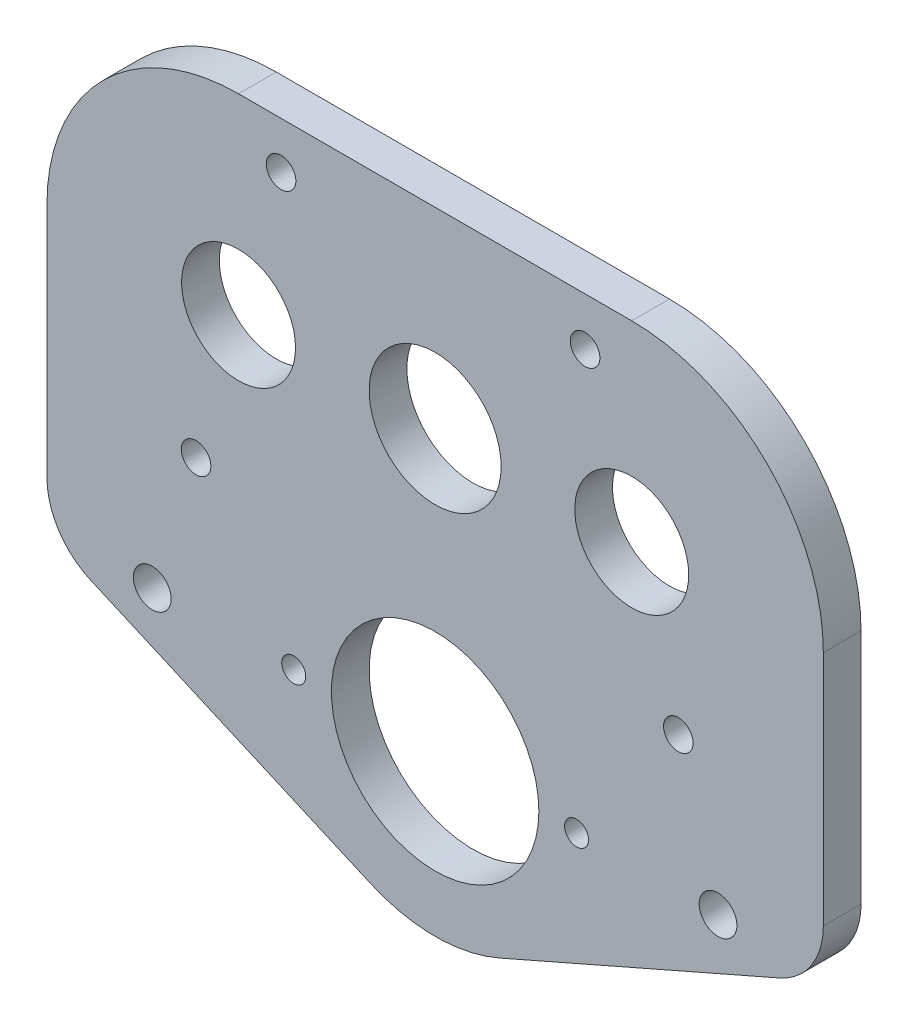
from build123d import *

# Parameters (mm, degrees)
SKETCH1_R           = 17.4625
SKETCH1_R_2         = 3.175
SKETCH1_R_3         = 2.0193
SKETCH1_R_4         = 11.1125
SKETCH1_R_5         = 9.5885
SKETCH1_R_6         = 2.4892
BOSS_EXTRUDE1_DEPTH = 3.175


with BuildPart() as part:
    # Sketch1 → Boss-Extrude1 (new, symmetric)
    with BuildSketch(Plane.XY):
        with BuildLine():
            Line((-65.3542, 47.0662), (-65.3542, 7.222562738))
            ThreePointArc((-65.3542, 7.222562738), (-63.348306044, 0.486916125), (-57.984239896, -4.053936242))
            Line((-57.984239896, -4.053936242), (-10.832597323, -24.718009456))
            ThreePointArc((-10.832597323, -24.718009456), (-5.8974e-05, -26.9875), (10.832489293, -24.7180568))
            Line((10.832489293, -24.7180568), (57.984190612, -4.054203495))
            ThreePointArc((57.984190612, -4.054203495), (63.348291325, 0.486647949), (65.3542, 7.222317083))
            Line((65.3542, 7.222317083), (65.3542, 47.0662))
            ThreePointArc((65.3542, 47.0662), (55.906050548, 69.876050548), (33.0962, 79.3242))
            Line((33.0962, 79.3242), (-33.0962, 79.3242))
            ThreePointArc((-33.0962, 79.3242), (-55.906050548, 69.876050548), (-65.3542, 47.0662))
        make_face()
        Circle(SKETCH1_R, mode=Mode.SUBTRACT)
        with Locations((47.625, 0)):
            Circle(SKETCH1_R_2, mode=Mode.SUBTRACT)
        with Locations((-23.8125, 0)):
            Circle(SKETCH1_R_3, mode=Mode.SUBTRACT)
        with Locations((-47.625, 0)):
            Circle(SKETCH1_R_2, mode=Mode.SUBTRACT)
        with Locations((23.8125, 0)):
            Circle(SKETCH1_R_3, mode=Mode.SUBTRACT)
        with Locations((0, 47.0662)):
            Circle(SKETCH1_R_4, mode=Mode.SUBTRACT)
        with Locations((33.0962, 47.0662)):
            Circle(SKETCH1_R_5, mode=Mode.SUBTRACT)
        with Locations((-33.0962, 47.0662)):
            Circle(SKETCH1_R_5, mode=Mode.SUBTRACT)
        with Locations((-25.940193056, 71.43732153)):
            Circle(SKETCH1_R_6, mode=Mode.SUBTRACT)
        with Locations((-40.252206944, 22.69507847)):
            Circle(SKETCH1_R_6, mode=Mode.SUBTRACT)
        with Locations((40.945231657, 22.909364486)):
            Circle(SKETCH1_R_6, mode=Mode.SUBTRACT)
        with Locations((25.247168343, 71.223035514)):
            Circle(SKETCH1_R_6, mode=Mode.SUBTRACT)
    extrude(amount=BOSS_EXTRUDE1_DEPTH, both=True)


solid = part.part
